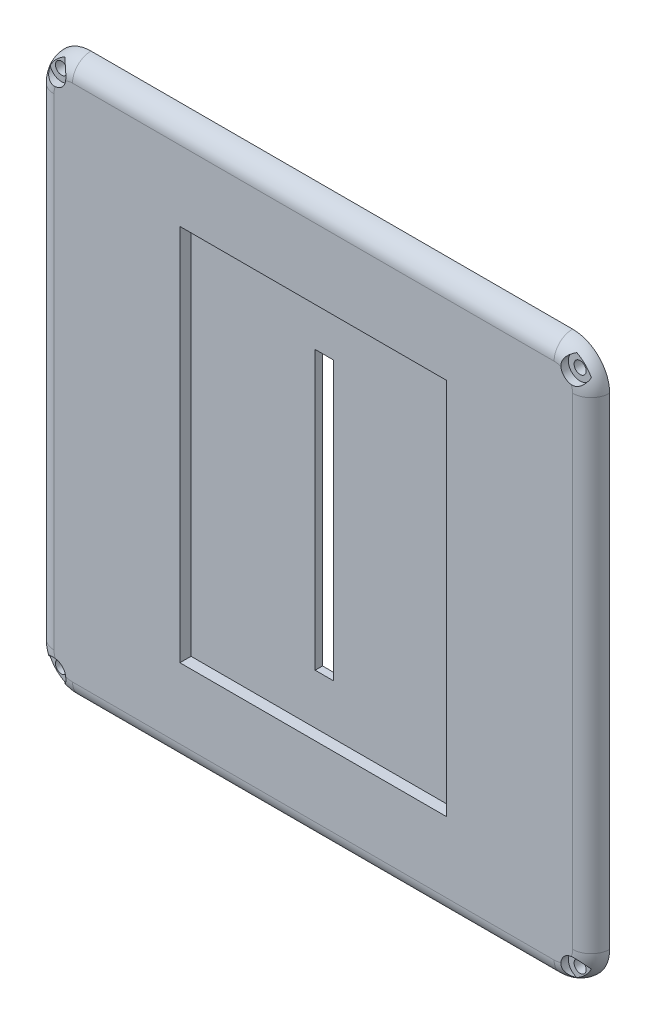
from build123d import *

# Parameters (mm, degrees)
CROQUIS1_W                                           = 150
CROQUIS1_H                                           = 150
SALIENTE_EXTRUIR1_DEPTH                              = 5
CROQUIS2_W                                           = 72
CROQUIS2_H                                           = 102
CORTAR_EXTRUIR1_DEPTH                                = 3
CROQUIS3_W                                           = 5
CROQUIS3_H                                           = 75
CORTAR_EXTRUIR2_DEPTH                                = 10
REDONDEO1_R                                          = 10
REDONDEO3_R                                          = 5
REFRENTADO_PARA_TORNILLO_CON_CABEZA_TRON_D           = 3.2639
REFRENTADO_PARA_TORNILLO_CON_CABEZA_TRON_DEPTH       = 50
REFRENTADO_PARA_TORNILLO_CON_CABEZA_TRON_CBORE_D     = 6.35
REFRENTADO_PARA_TORNILLO_CON_CABEZA_TRON_CBORE_DEPTH = 2.032
REFRENTADO_PARA_TORNILLO_CON_CABEZA_TRON_TIP         = 0.980574487


with BuildPart() as part:
    # Croquis1 → Saliente-Extruir1 (new body)
    with BuildSketch(Plane.XY):
        Rectangle(CROQUIS1_W, CROQUIS1_H)
    extrude(amount=SALIENTE_EXTRUIR1_DEPTH)

    # Croquis2 → Cortar-Extruir1 (cut)
    with BuildSketch(Plane.XY.offset(5)):
        Rectangle(CROQUIS2_W, CROQUIS2_H)
    extrude(amount=-CORTAR_EXTRUIR1_DEPTH, mode=Mode.SUBTRACT)

    # Croquis3 → Cortar-Extruir2 (cut)
    with BuildSketch(Plane.XY.offset(5)):
        Rectangle(CROQUIS3_W, CROQUIS3_H)
    extrude(amount=-CORTAR_EXTRUIR2_DEPTH, mode=Mode.SUBTRACT)

    # Redondeo1
    redondeo1_edges = [part.edges().sort_by_distance(p)[0] for p in [
        (75, -75, 2.5),
        (-75, -75, 2.5),
        (-75, 75, 2.5),
        (75, 75, 2.5),
    ]]
    fillet(redondeo1_edges, radius=REDONDEO1_R)

    # Redondeo3
    redondeo3_edges = [part.edges().sort_by_distance(p)[0] for p in [
        (72.071067812, 72.071067812, 5),
        (75, 0, 5),
        (72.071067812, -72.071067812, 5),
        (0, -75, 5),
        (-72.071067812, -72.071067812, 5),
        (-75, 0, 5),
        (-72.071067812, 72.071067812, 5),
        (0, 75, 5),
    ]]
    fillet(redondeo3_edges, radius=REDONDEO3_R - 0.0001)  # a hair under: the kernel refuses the full size

    # Refrentado para tornillo con cabeza troncocónica de #41
    with Locations(Plane.XY.offset(5)):
        with Locations((-70, 70), (-70, -70), (70, -70), (70, 70)):
            CounterBoreHole(REFRENTADO_PARA_TORNILLO_CON_CABEZA_TRON_D / 2, REFRENTADO_PARA_TORNILLO_CON_CABEZA_TRON_CBORE_D / 2, REFRENTADO_PARA_TORNILLO_CON_CABEZA_TRON_CBORE_DEPTH, depth=REFRENTADO_PARA_TORNILLO_CON_CABEZA_TRON_DEPTH)
            with Locations((0, 0, -(REFRENTADO_PARA_TORNILLO_CON_CABEZA_TRON_DEPTH + REFRENTADO_PARA_TORNILLO_CON_CABEZA_TRON_TIP / 2))):  # 118° drill point
                Cone(0, REFRENTADO_PARA_TORNILLO_CON_CABEZA_TRON_D / 2, REFRENTADO_PARA_TORNILLO_CON_CABEZA_TRON_TIP, mode=Mode.SUBTRACT)


solid = part.part
